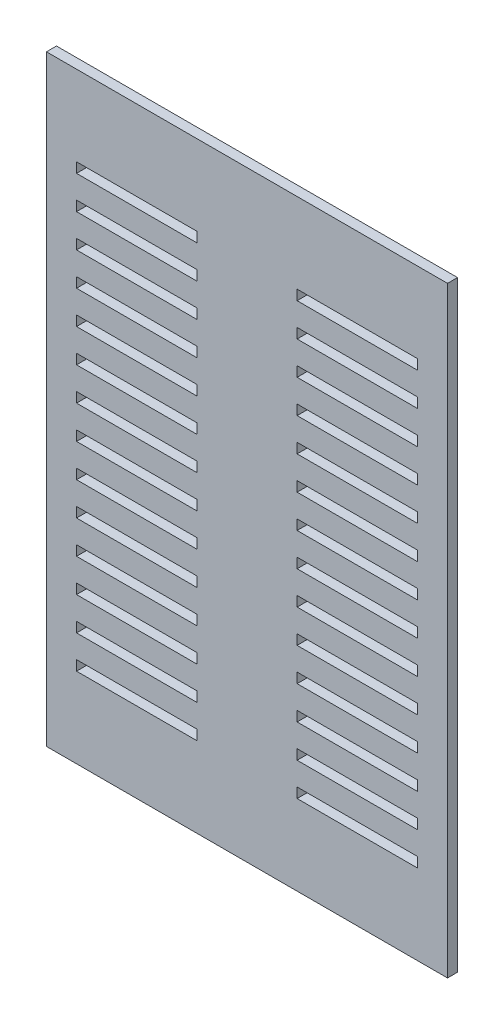
from build123d import *

# Parameters (mm, degrees)
CROQUIS1_W              = 200
CROQUIS1_H              = 300
SALIENTE_EXTRUIR1_DEPTH = 5
CROQUIS2_W              = 60
CROQUIS2_H              = 5
CORTAR_EXTRUIR1_DEPTH   = 181.346887969


with BuildPart() as part:
    # Croquis1 → Saliente-Extruir1 (new body)
    with BuildSketch(Plane.XY):
        Rectangle(CROQUIS1_W, CROQUIS1_H)
    extrude(amount=SALIENTE_EXTRUIR1_DEPTH)

    # Croquis2 → Cortar-Extruir1 (cut, through all)
    with BuildSketch(Plane.XY.offset(5)):
        with Locations((-55, 107.5)):
            Rectangle(CROQUIS2_W, CROQUIS2_H)
        with Locations((55, 107.5)):
            Rectangle(CROQUIS2_W, CROQUIS2_H)
        with Locations((55, 90.961538462)):
            Rectangle(CROQUIS2_W, CROQUIS2_H)
        with Locations((55, 74.423076923)):
            Rectangle(CROQUIS2_W, CROQUIS2_H)
        with Locations((55, 57.884615385)):
            Rectangle(CROQUIS2_W, CROQUIS2_H)
        with Locations((55, 41.346153846)):
            Rectangle(CROQUIS2_W, CROQUIS2_H)
        with Locations((55, 24.807692308)):
            Rectangle(CROQUIS2_W, CROQUIS2_H)
        with Locations((55, 8.269230769)):
            Rectangle(CROQUIS2_W, CROQUIS2_H)
        with Locations((55, -8.269230769)):
            Rectangle(CROQUIS2_W, CROQUIS2_H)
        with Locations((55, -24.807692308)):
            Rectangle(CROQUIS2_W, CROQUIS2_H)
        with Locations((55, -41.346153846)):
            Rectangle(CROQUIS2_W, CROQUIS2_H)
        with Locations((55, -57.884615385)):
            Rectangle(CROQUIS2_W, CROQUIS2_H)
        with Locations((55, -74.423076923)):
            Rectangle(CROQUIS2_W, CROQUIS2_H)
        with Locations((55, -90.961538462)):
            Rectangle(CROQUIS2_W, CROQUIS2_H)
        with Locations((55, -107.5)):
            Rectangle(CROQUIS2_W, CROQUIS2_H)
        with Locations((-55, 90.961538462)):
            Rectangle(CROQUIS2_W, CROQUIS2_H)
        with Locations((-55, 74.423076923)):
            Rectangle(CROQUIS2_W, CROQUIS2_H)
        with Locations((-55, 57.884615385)):
            Rectangle(CROQUIS2_W, CROQUIS2_H)
        with Locations((-55, 41.346153846)):
            Rectangle(CROQUIS2_W, CROQUIS2_H)
        with Locations((-55, 24.807692308)):
            Rectangle(CROQUIS2_W, CROQUIS2_H)
        with Locations((-55, 8.269230769)):
            Rectangle(CROQUIS2_W, CROQUIS2_H)
        with Locations((-55, -8.269230769)):
            Rectangle(CROQUIS2_W, CROQUIS2_H)
        with Locations((-55, -24.807692308)):
            Rectangle(CROQUIS2_W, CROQUIS2_H)
        with Locations((-55, -41.346153846)):
            Rectangle(CROQUIS2_W, CROQUIS2_H)
        with Locations((-55, -57.884615385)):
            Rectangle(CROQUIS2_W, CROQUIS2_H)
        with Locations((-55, -74.423076923)):
            Rectangle(CROQUIS2_W, CROQUIS2_H)
        with Locations((-55, -90.961538462)):
            Rectangle(CROQUIS2_W, CROQUIS2_H)
        with Locations((-55, -107.5)):
            Rectangle(CROQUIS2_W, CROQUIS2_H)
    extrude(amount=-CORTAR_EXTRUIR1_DEPTH, mode=Mode.SUBTRACT)


solid = part.part
